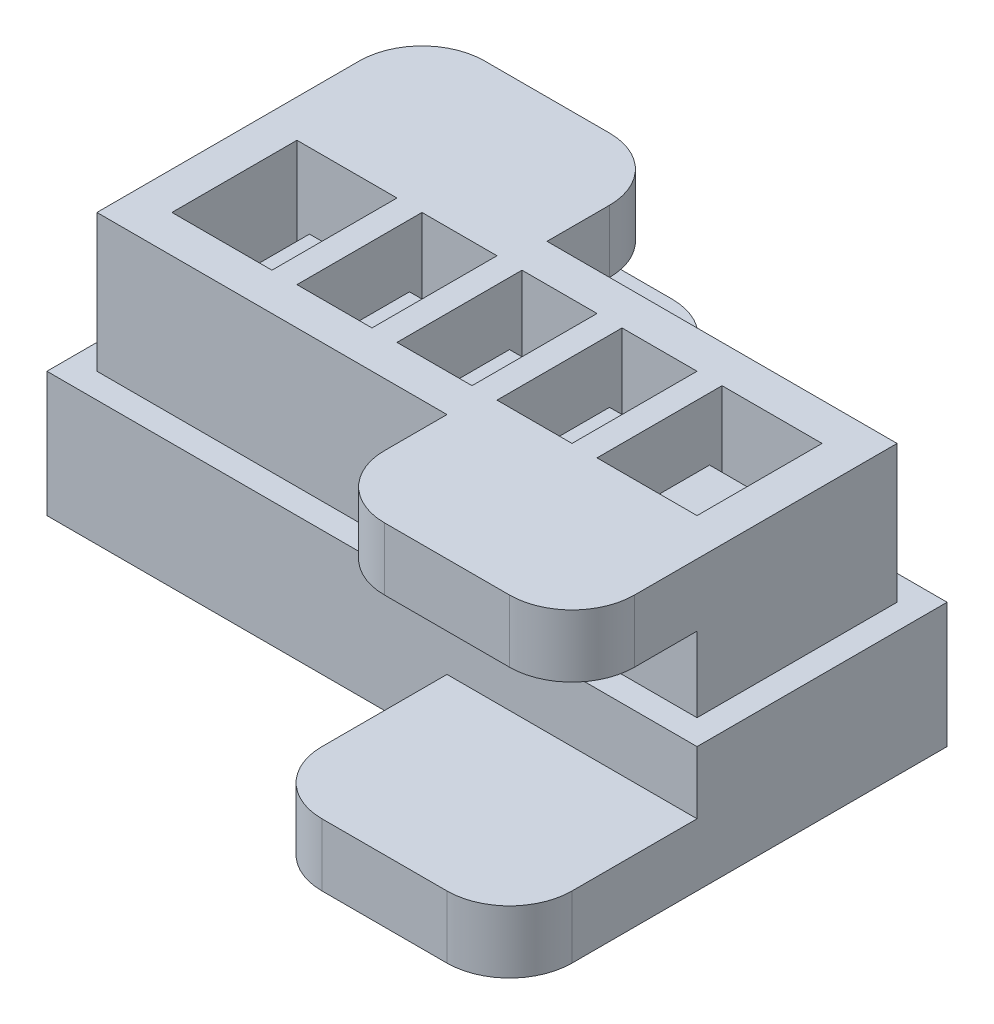
from build123d import *

# Parameters (mm, degrees)
SKETCH1_W                = 6
SKETCH1_H                = 10
BOSS_EXTRUDE1_DEPTH      = 15
SKETCH2_W                = 4
SKETCH2_H                = 6
CUT_EXTRUDE1_DEPTH       = 11
SKETCH3_W                = 10
SKETCH3_H                = 4
BOSS_EXTRUDE2_DEPTH      = 2
LPATTERN1_COUNT          = 5
LPATTERN1_PITCH          = 8
SKETCH4_W                = 10
SKETCH4_H                = 11
BOSS_EXTRUDE3_DEPTH      = 2
SKETCH5_W                = 10
SKETCH5_H                = 15
BOSS_EXTRUDE4_DEPTH      = 2
SKETCH6_W                = 36
SKETCH6_H                = 2
CUT_EXTRUDE2_DEPTH       = 2
BOSS_EXTRUDE7_DEPTH      = 15
BOSS_EXTRUDE7_DEPTH_BACK = 6
SKETCH9_W                = 48
SKETCH9_H                = 16
SPLIT1_START             = -6
SPLIT1_OUTLINE_W         = 48
SPLIT1_OUTLINE_H         = 16
SPLIT1_DEPTH             = 6
SPLIT1_2_OUTLINE_W       = 4
SPLIT1_2_OUTLINE_H       = 6
SPLIT1_2_DEPTH           = 11
SPLIT1_3_OUTLINE_W       = 4
SPLIT1_3_OUTLINE_H       = 2
SPLIT1_3_DEPTH           = 2
SPLIT1_START_2           = -13
SPLIT1_4_OUTLINE_W       = 48
SPLIT1_4_OUTLINE_H       = 6
SPLIT1_4_DEPTH           = 16
SPLIT1_START_3           = -8
SPLIT1_5_OUTLINE_W       = 4
SPLIT1_5_OUTLINE_H       = 11
SPLIT1_5_DEPTH           = 6
SPLIT1_6_OUTLINE_W       = 4
SPLIT1_6_OUTLINE_H       = 2
SPLIT1_6_DEPTH           = 2
SKETCH11_W               = 20
SKETCH11_H               = 5
BOSS_EXTRUDE8_DEPTH      = 10
SKETCH12_W               = 20
SKETCH12_H               = 5
BOSS_EXTRUDE9_DEPTH      = 10
FILLET1_R                = 5
SKETCH13_W               = 52
SKETCH13_H               = 20
SKETCH13_W_2             = 48
SKETCH13_H_2             = 16
BOSS_EXTRUDE11_DEPTH     = 10
SKETCH14_W               = 20
SKETCH14_H               = 5
BOSS_EXTRUDE12_DEPTH     = 15
SKETCH15_W               = 20
SKETCH15_H               = 5
BOSS_EXTRUDE13_DEPTH     = 15
FILLET2_R                = 5


# Read off the part's stored shape, not the designer's step: Split1
with BuildPart() as part:
    # Sketch1 → Boss-Extrude1 (new body)
    with BuildSketch(Plane(origin=(0, 0, 0), x_dir=(1, 0, 0), z_dir=(0, 1, 0))):
        with Locations((3, 5)):
            Rectangle(SKETCH1_W, SKETCH1_H)
    extrude(amount=BOSS_EXTRUDE1_DEPTH)

    # Sketch2 → Cut-Extrude1 (cut)
    with BuildSketch(Plane.XZ):
        with Locations((3, -5)):
            Rectangle(SKETCH2_W, SKETCH2_H)
    extrude(amount=-CUT_EXTRUDE1_DEPTH, mode=Mode.SUBTRACT)

    # Sketch3 → Boss-Extrude2 (add)
    with BuildSketch(Plane.ZY):
        with Locations((-5, 2)):
            Rectangle(SKETCH3_W, SKETCH3_H)
    extrude(amount=BOSS_EXTRUDE2_DEPTH)


with BuildPart() as lpattern1_1:
    # LPattern1: pattern copy
    add(part.part.moved(Location(Vector(-1, 0, 0) * (1 * LPATTERN1_PITCH))))


with BuildPart() as lpattern1_2:
    # LPattern1: pattern copy
    add(part.part.moved(Location(Vector(-1, 0, 0) * (2 * LPATTERN1_PITCH))))


with BuildPart() as lpattern1_3:
    # LPattern1: pattern copy
    add(part.part.moved(Location(Vector(-1, 0, 0) * (3 * LPATTERN1_PITCH))))


with BuildPart() as lpattern1_4:
    # LPattern1: pattern copy
    add(part.part.moved(Location(Vector(-1, 0, 0) * (4 * LPATTERN1_PITCH))))


with BuildPart() as lpattern1_2_1:
    add(lpattern1_2.part)

    # Combine1: union LPattern1_1, part, LPattern1_3, LPattern1_4
    add(lpattern1_1.part)
    add(part.part)
    add(lpattern1_3.part)
    add(lpattern1_4.part)

    # Sketch4 → Boss-Extrude3 (add)
    with BuildSketch(Plane.ZY.offset(32)):
        with Locations((-5, 9.5)):
            Rectangle(SKETCH4_W, SKETCH4_H)
    extrude(amount=BOSS_EXTRUDE3_DEPTH)

    # Sketch5 → Boss-Extrude4 (add)
    with BuildSketch(Plane(origin=(6, 0, 0), x_dir=(0, 0, -1), z_dir=(1, 0, 0))):
        with Locations((5, 7.5)):
            Rectangle(SKETCH5_W, SKETCH5_H)
    extrude(amount=BOSS_EXTRUDE4_DEPTH)

    # Sketch6 → Cut-Extrude2 (cut)
    with BuildSketch(Plane(origin=(0, 0, 0), x_dir=(-1, 0, 0), z_dir=(0, -1, 0))):
        with Locations((13, 5)):
            Rectangle(SKETCH6_W, SKETCH6_H)
    extrude(amount=-CUT_EXTRUDE2_DEPTH, mode=Mode.SUBTRACT)


with BuildPart() as body_2:
    # Sketch9 → Boss-Extrude7 (new, two sides: drawn at the far end of the back side and taken through both)
    with BuildSketch(Plane(origin=(0, 0, 0), x_dir=(1, 0, 0), z_dir=(0, 1, 0)).offset(-BOSS_EXTRUDE7_DEPTH_BACK)):
        with Locations((-13, 5)):
            Rectangle(SKETCH9_W, SKETCH9_H)
    extrude(amount=BOSS_EXTRUDE7_DEPTH + BOSS_EXTRUDE7_DEPTH_BACK)

    # Combine2: cut LPattern1_2
    add(lpattern1_2_1.part, mode=Mode.SUBTRACT)

    # Split1 outline → Split1 (cut)
    with BuildSketch(Plane(origin=(0, 0, 0), x_dir=(1, 0, 0), z_dir=(0, 1, 0)).offset(SPLIT1_START)):
        with Locations((-13, 5)):
            Rectangle(SPLIT1_OUTLINE_W, SPLIT1_OUTLINE_H)
    extrude(amount=SPLIT1_DEPTH, mode=Mode.SUBTRACT)

    # Split1 2 outline → Split1 2 (cut)
    with BuildSketch(Plane(origin=(0, 0, 0), x_dir=(1, 0, 0), z_dir=(0, 1, 0))):
        with Locations((-13, 5)):
            Rectangle(SPLIT1_2_OUTLINE_W, SPLIT1_2_OUTLINE_H)
        with Locations((-5, 5)):
            Rectangle(SPLIT1_2_OUTLINE_W, SPLIT1_2_OUTLINE_H)
        with Locations((-21, 5)):
            Rectangle(SPLIT1_2_OUTLINE_W, SPLIT1_2_OUTLINE_H)
        with Locations((3, 5)):
            Rectangle(SPLIT1_2_OUTLINE_W, SPLIT1_2_OUTLINE_H)
        with Locations((-29, 5)):
            Rectangle(SPLIT1_2_OUTLINE_W, SPLIT1_2_OUTLINE_H)
    extrude(amount=SPLIT1_2_DEPTH, mode=Mode.SUBTRACT)

    # Split1 3 outline → Split1 3 (cut)
    with BuildSketch(Plane(origin=(0, 0, 0), x_dir=(1, 0, 0), z_dir=(0, 1, 0))):
        with Locations((-9, 5)):
            Rectangle(SPLIT1_3_OUTLINE_W, SPLIT1_3_OUTLINE_H)
        with Locations((-17, 5)):
            Rectangle(SPLIT1_3_OUTLINE_W, SPLIT1_3_OUTLINE_H)
        with Locations((-1, 5)):
            Rectangle(SPLIT1_3_OUTLINE_W, SPLIT1_3_OUTLINE_H)
        with Locations((-25, 5)):
            Rectangle(SPLIT1_3_OUTLINE_W, SPLIT1_3_OUTLINE_H)
    extrude(amount=SPLIT1_3_DEPTH, mode=Mode.SUBTRACT)

    # Sketch11 → Boss-Extrude8 (add)
    with BuildSketch(Plane.XY.offset(3)):
        with Locations((1, 12.5)):
            Rectangle(SKETCH11_W, SKETCH11_H)
    extrude(amount=BOSS_EXTRUDE8_DEPTH)

    # Sketch12 → Boss-Extrude9 (add)
    with BuildSketch(Plane(origin=(0, 0, -13), x_dir=(-1, 0, 0), z_dir=(0, 0, -1))):
        with Locations((27, 12.5)):
            Rectangle(SKETCH12_W, SKETCH12_H)
    extrude(amount=BOSS_EXTRUDE9_DEPTH)

    # Fillet1
    fillet1_edges = [body_2.edges().sort_by_distance(p)[0] for p in [
        (11, 12.5, 13),
        (-9, 12.5, 13),
        (-37, 12.5, -23),
        (-17, 12.5, -23),
    ]]
    fillet(fillet1_edges, radius=FILLET1_R)


with BuildPart() as body_2_2:
    # Split1 4 outline → Split1 4 (new body)
    with BuildSketch(Plane.XY.offset(SPLIT1_START_2)):
        with Locations((-13, -3)):
            Rectangle(SPLIT1_4_OUTLINE_W, SPLIT1_4_OUTLINE_H)
    extrude(amount=SPLIT1_4_DEPTH)

    # Split1 5 outline → Split1 5 (add)
    with BuildSketch(Plane.XY.offset(SPLIT1_START_3)):
        with Locations((-29, 5.5)):
            Rectangle(SPLIT1_5_OUTLINE_W, SPLIT1_5_OUTLINE_H)
        with Locations((-21, 5.5)):
            Rectangle(SPLIT1_5_OUTLINE_W, SPLIT1_5_OUTLINE_H)
        with Locations((-13, 5.5)):
            Rectangle(SPLIT1_5_OUTLINE_W, SPLIT1_5_OUTLINE_H)
        with Locations((3, 5.5)):
            Rectangle(SPLIT1_5_OUTLINE_W, SPLIT1_5_OUTLINE_H)
        with Locations((-5, 5.5)):
            Rectangle(SPLIT1_5_OUTLINE_W, SPLIT1_5_OUTLINE_H)
    extrude(amount=SPLIT1_5_DEPTH)

    # Split1 6 outline → Split1 6 (add)
    with BuildSketch(Plane.XY.offset(SPLIT1_START)):
        with Locations((-25, 1)):
            Rectangle(SPLIT1_6_OUTLINE_W, SPLIT1_6_OUTLINE_H)
        with Locations((-17, 1)):
            Rectangle(SPLIT1_6_OUTLINE_W, SPLIT1_6_OUTLINE_H)
        with Locations((-9, 1)):
            Rectangle(SPLIT1_6_OUTLINE_W, SPLIT1_6_OUTLINE_H)
        with Locations((-1, 1)):
            Rectangle(SPLIT1_6_OUTLINE_W, SPLIT1_6_OUTLINE_H)
    extrude(amount=SPLIT1_6_DEPTH)

    # Sketch13 → Boss-Extrude11 (add)
    with BuildSketch(Plane.XZ.offset(6)):
        with Locations((-13, -5)):
            Rectangle(SKETCH13_W, SKETCH13_H)
        with Locations((-13, -5)):
            Rectangle(SKETCH13_W_2, SKETCH13_H_2, mode=Mode.SUBTRACT)
    extrude(amount=-BOSS_EXTRUDE11_DEPTH)

    # Sketch14 → Boss-Extrude12 (add)
    with BuildSketch(Plane.XY.offset(5)):
        with Locations((3, -3.5)):
            Rectangle(SKETCH14_W, SKETCH14_H)
    extrude(amount=BOSS_EXTRUDE12_DEPTH)

    # Sketch15 → Boss-Extrude13 (add)
    with BuildSketch(Plane(origin=(0, 0, -15), x_dir=(-1, 0, 0), z_dir=(0, 0, -1))):
        with Locations((29, -3.5)):
            Rectangle(SKETCH15_W, SKETCH15_H)
    extrude(amount=BOSS_EXTRUDE13_DEPTH)

    # Fillet2
    fillet2_edges = [body_2_2.edges().sort_by_distance(p)[0] for p in [
        (13, -3.5, 20),
        (-7, -3.5, 20),
        (-39, -3.5, -30),
        (-19, -3.5, -30),
    ]]
    fillet(fillet2_edges, radius=FILLET2_R)


solid = Compound([body_2.part, body_2_2.part])
